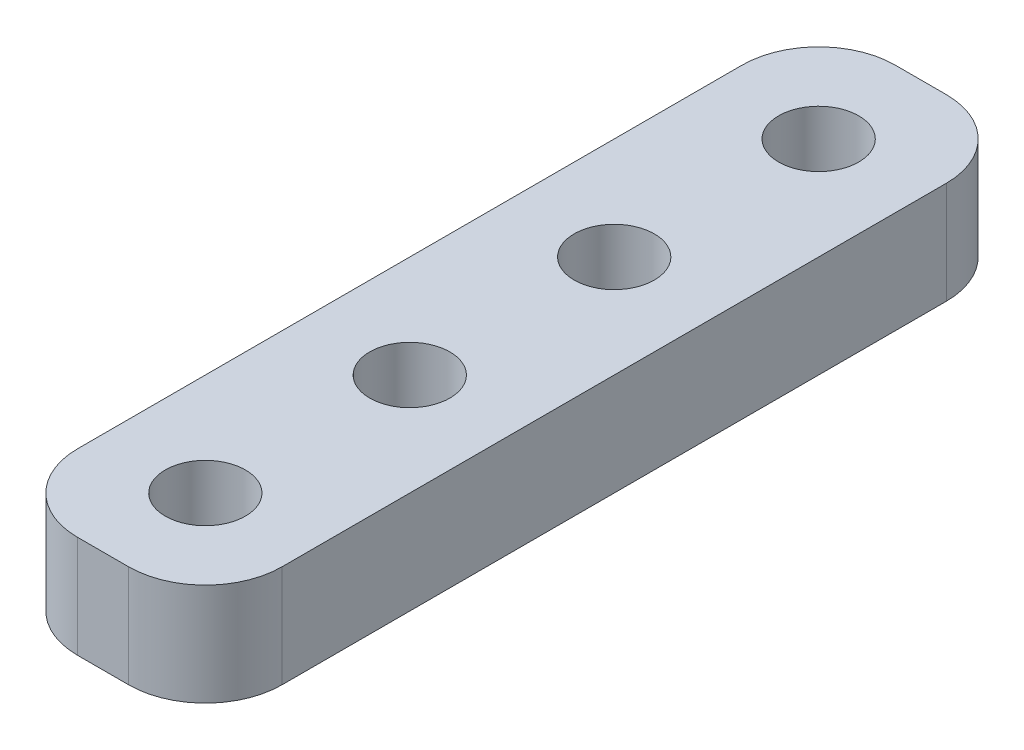
from build123d import *

# Parameters (mm, degrees)
SKETCH1_W           = 12.7
SKETCH1_H           = 50.8
SKETCH1_R           = 2.4892
BOSS_EXTRUDE1_DEPTH = 6.35
LPATTERN1_OUTLINE_R = 2.4892
LPATTERN1_DEPTH     = 6.35
FILLET1_R           = 4.7625


# Read off the part's stored shape, not the designer's step: LPattern1
with BuildPart() as part:
    # Sketch1 → Boss-Extrude1 (new body)
    with BuildSketch(Plane(origin=(0, 0, 0), x_dir=(1, 0, 0), z_dir=(0, 1, 0))):
        with Locations((6.35, 25.4)):
            Rectangle(SKETCH1_W, SKETCH1_H)
        with Locations(Location((6.35, 6.35, 0), (0, 0, 270))):
            Circle(SKETCH1_R, mode=Mode.SUBTRACT)
    extrude(amount=BOSS_EXTRUDE1_DEPTH)

    # LPattern1 outline → LPattern1 (cut)
    with BuildSketch(Plane(origin=(0, 0, 0), x_dir=(1, 0, 0), z_dir=(0, 1, 0))):
        with Locations((6.35, 44.45)):
            Circle(LPATTERN1_OUTLINE_R)
        with Locations((6.35, 31.75)):
            Circle(LPATTERN1_OUTLINE_R)
        with Locations((6.35, 19.05)):
            Circle(LPATTERN1_OUTLINE_R)
    extrude(amount=LPATTERN1_DEPTH, mode=Mode.SUBTRACT)

    # Fillet1
    fillet1_edges = [part.edges().sort_by_distance(p)[0] for p in [
        (0, 3.175, -50.8),
        (12.7, 3.175, -50.8),
        (12.7, 3.175, 0),
        (0, 3.175, 0),
    ]]
    fillet(fillet1_edges, radius=FILLET1_R)


solid = part.part
